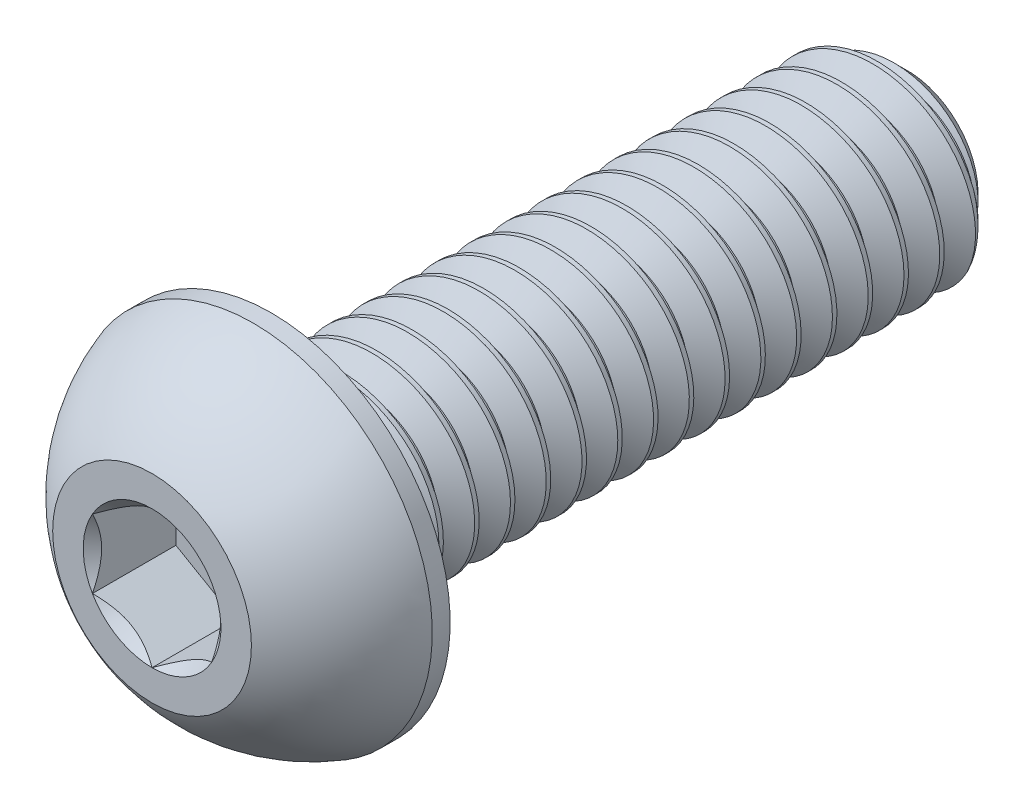
from build123d import *

# Parameters (mm, degrees)
CUT_EXTRUDE1_DEPTH = 1.05
CUT_SWEEP1_PITCH   = 0.45


# Read off the part's stored shape, not the designer's step: Split1, Boss-Extrude1
with BuildPart() as part:
    # Sketch2 → Revolve1 (revolve)
    with BuildSketch(Plane(origin=(0, 0, 0), x_dir=(0, 0, -1), z_dir=(1, 0, 0)), mode=Mode.PRIVATE) as revolve1_sk:
        with BuildLine():
            Line((-4.75, 0), (4.75, 0))
            Line((4.75, 0), (4.75, 0.89))
            Line((4.75, 0.89), (4.39, 1.25))
            Line((4.39, 1.25), (-3.25, 1.25))
            Line((-3.25, 1.25), (-3.25, 2.25))
            Line((-3.25, 2.25), (-3.475, 2.25))
            ThreePointArc((-3.475, 2.25), (-4.200735294, 1.8625), (-4.75, 1.25))
            Line((-4.75, 1.25), (-4.75, 0))
        make_face()
    revolve(revolve1_sk.sketch.rotate(Axis((0, 0, 4.75), (0, 0, -1)), 180), axis=Axis((0, 0, 4.75), (0, 0, -1)))

    # Sketch3 → Cut-Extrude1 (cut)
    with BuildSketch(Plane.XY.offset(4.75)):
        Polygon((0, 0.866025404), (-0.75, 0.433012702), (-0.75, -0.433012702), (0, -0.866025404), (0.75, -0.433012702), (0.75, 0.433012702), align=None)
    extrude(amount=-CUT_EXTRUDE1_DEPTH, mode=Mode.SUBTRACT)

    # Cut-Extrude2 cone 1 section (through the dimple's axis) → Cut-Extrude2 (revolve, cut)
    with BuildSketch(Plane(origin=(0, 0, 4.75), x_dir=(0, -1, 0), z_dir=(1, 0, 0))):
        Polygon((0, 0), (0.866025404, 0), (0, 0.866025404), align=None)
    revolve(axis=Axis((0, 0, 4.75), (0, 0, -1)), mode=Mode.SUBTRACT)


with BuildPart() as body_2:
    # Split1: the piece on the far side of the plane
    add(part.part)
    split(bisect_by=Plane.XY.offset(3.25), keep=Keep.BOTTOM)

    # Cut-Sweep1: the profile of Sketch6 screwed along a right-hand helix of 18.777778 turns, 6 arcs to a turn; built about Z, then put on its axis
    cut_sweep1_z = Axis((0, 0, 0), (0, 0, 1))
    cut_sweep1_corners = [(0.957716426, 0, -0.16875), (0.957716426, 0, -0.225), (1.274356964, 0, -0.4078125), (1.274356964, 0, 0.0140625)]
    with BuildLine(mode=Mode.PRIVATE) as cut_sweep1_profile:
        Line(cut_sweep1_corners[0], cut_sweep1_corners[1])
        Line(cut_sweep1_corners[1], cut_sweep1_corners[2])
        Line(cut_sweep1_corners[2], cut_sweep1_corners[3])
        Line(cut_sweep1_corners[3], cut_sweep1_corners[0])
    cut_sweep1_cap = Face(cut_sweep1_profile.wire())
    cut_sweep1_turn_angles = [0, 30, 60, 90, 120, 150, 180, 210, 240, 270, 300, 330, 360]
    cut_sweep1_turn_weights = [1, 0.8660254037844387, 1, 0.8660254037844387, 1, 0.8660254037844387, 1, 0.8660254037844387, 1, 0.8660254037844387, 1, 0.8660254037844387, 1]
    cut_sweep1_turn_rails = [Edge.make_bspline([Vector(p[0], p[1], 0).rotate(cut_sweep1_z, cut_sweep1_turn_angles[k]) / cut_sweep1_turn_weights[k] + Vector(0, 0, p[2] + CUT_SWEEP1_PITCH * cut_sweep1_turn_angles[k] / 360) for k in range(13)], [0, 0, 0, 1, 1, 2, 2, 3, 3, 4, 4, 5, 5, 6, 6, 6], 2, cut_sweep1_turn_weights) for p in cut_sweep1_corners]
    cut_sweep1_turn_sides = [Face.make_surface_from_curves(cut_sweep1_turn_rails[p[0]], cut_sweep1_turn_rails[p[1]]) for p in [(0, 1), (1, 2), (2, 3), (3, 0)]]
    cut_sweep1_last_angles = [6480, 6510, 6540, 6570, 6600, 6630, 6660, 6690, 6720, 6740, 6760]
    cut_sweep1_last_weights = [1, 0.8660254037844387, 1, 0.8660254037844387, 1, 0.8660254037844387, 1, 0.8660254037844387, 1, 0.9396926207857157, 1]
    cut_sweep1_last_rails = [Edge.make_bspline([Vector(p[0], p[1], 0).rotate(cut_sweep1_z, cut_sweep1_last_angles[k]) / cut_sweep1_last_weights[k] + Vector(0, 0, p[2] + CUT_SWEEP1_PITCH * cut_sweep1_last_angles[k] / 360) for k in range(11)], [0, 0, 0, 1, 1, 2, 2, 3, 3, 4, 4, 5, 5, 5], 2, cut_sweep1_last_weights) for p in cut_sweep1_corners]
    cut_sweep1_last_sides = [Face.make_surface_from_curves(cut_sweep1_last_rails[p[0]], cut_sweep1_last_rails[p[1]]) for p in [(0, 1), (1, 2), (2, 3), (3, 0)]]
    cut_sweep1 = Plane(origin=(0, 0, -4.75), x_dir=(0, 1, 0), z_dir=(0, 0, 1)) * Solid(Shell([*[p.moved(Location((0, 0, CUT_SWEEP1_PITCH * i))) for i in range(18) for p in cut_sweep1_turn_sides], *cut_sweep1_last_sides, cut_sweep1_cap, cut_sweep1_cap.rotate(cut_sweep1_z, 6760).moved(Location((0, 0, CUT_SWEEP1_PITCH * 6760 / 360)))]))
    add(cut_sweep1, mode=Mode.SUBTRACT)


with BuildPart() as part_1:
    add(part.part)

    # Split1
    split(bisect_by=Plane.XY.offset(3.25), keep=Keep.TOP)

    add(body_2.part)  # Boss-Extrude1 merges body 2
    # Boss-Extrude1 outline → Boss-Extrude1 (revolve)
    with BuildSketch(Plane.XZ):
        Polygon((0.957714811, 3.25), (0.957714811, 2.743747202), (1.25, 3.25), align=None)
    revolve(axis=Axis((0, 0, 0), (0, 0, 1)))


solid = part_1.part
